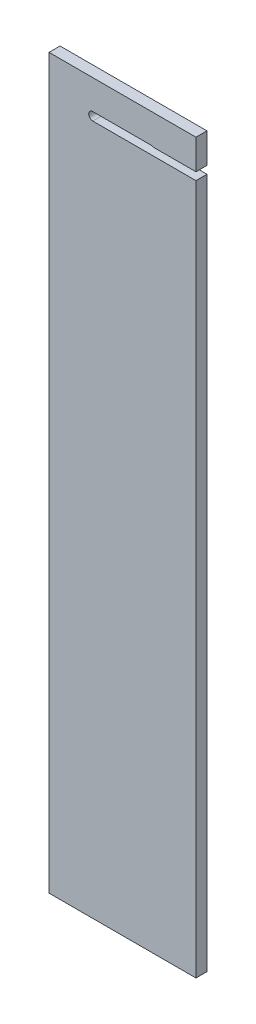
from build123d import *

# Parameters (mm, degrees)
BOSS_EXTRUDE1_DEPTH = 4.7625
FILLET1_R           = 3.175


with BuildPart() as part:
    # Sketch1 → Boss-Extrude1 (new body)
    with BuildSketch(Plane.XY):
        with BuildLine():
            Line((-31.75, 165.481), (-31.75, 149.225))
            Line((-31.75, 149.225), (-12.827, 149.225))
            ThreePointArc((-12.827, 149.225), (-14.605, 151.003), (-12.827, 152.781))
            Line((-12.827, 152.781), (12.827, 152.781))
            Line((12.827, 152.781), (12.827, 152.527))
            Line((12.827, 152.527), (31.75, 152.527))
            Line((31.75, 152.527), (31.75, 165.481))
            Line((31.75, 165.481), (-31.75, 165.481))
        make_face()
        Polygon((-12.827, 149.225), (-31.75, 149.225), (-31.75, -149.225), (31.75, -149.225), (31.75, 149.225), align=None)
    extrude(amount=BOSS_EXTRUDE1_DEPTH)

    # Fillet1
    # the kernel refuses this fillet: 3.175 mm, written as the material it takes off along each edge
    with BuildSketch(Plane(origin=(12.827, 152.527, -3.110851973), x_dir=(0, 1, 0), z_dir=(0, 0, 1))) as fillet1_piece_1:
        with BuildLine():
            CenterArc((3.175, -1.244340789), FILLET1_R, 156.926081934, 23.073918066)
            Line((0, -1.244340789), (-0.0635, -1.244340789))
            Line((-0.0635, -1.244340789), (-0.0635, 0))
            Line((-0.0635, 0), (0, 0.0635))
            ThreePointArc((0, 0.0635), (0.127, 0.0635), (0.19558, 0.024886816))
            Line((0.19558, 0.024886816), (0.254, 0))
        make_face()
    extrude(amount=10.984203947, mode=Mode.SUBTRACT)


solid = part.part
